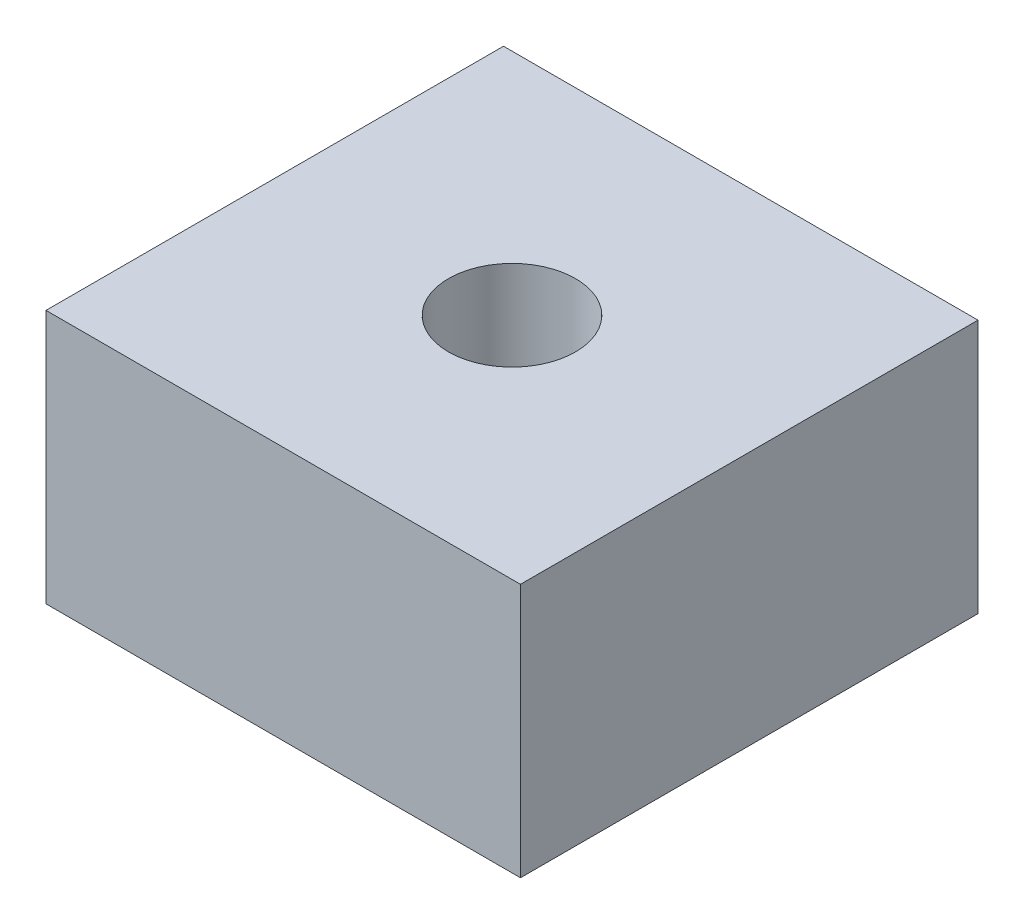
from build123d import *

# Parameters (mm, degrees)
SKETCH1_W           = 5.6
SKETCH1_H           = 5.4
SKETCH1_R           = 0.75
BOSS_EXTRUDE1_DEPTH = 3


with BuildPart() as part:
    # Sketch1 → Boss-Extrude1 (new body)
    with BuildSketch(Plane(origin=(0, 0, 0), x_dir=(1, 0, 0), z_dir=(0, 1, 0))):
        Rectangle(SKETCH1_W, SKETCH1_H)
        Circle(SKETCH1_R, mode=Mode.SUBTRACT)
    extrude(amount=BOSS_EXTRUDE1_DEPTH)


solid = part.part
